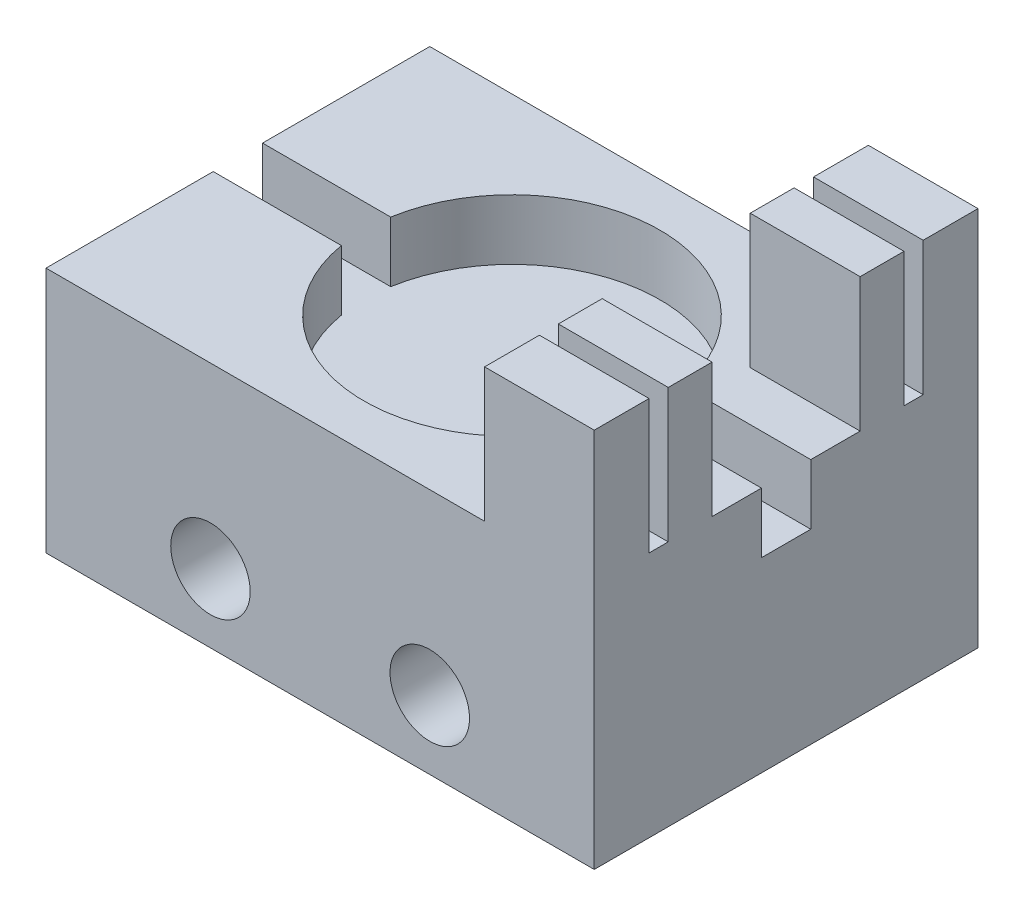
from build123d import *

# Parameters (mm, degrees)
SKETCH1_W           = 50
SKETCH1_H           = 22.5
BOSS_EXTRUDE1_DEPTH = 35
SKETCH2_R           = 3.625
CUT_EXTRUDE1_DEPTH  = 35
CUT_EXTRUDE2_DEPTH  = 5.5
SKETCH4_W           = 10
SKETCH4_H           = 5
SKETCH4_W_2         = 10.024005515
SKETCH4_H_2         = 4
BOSS_EXTRUDE2_DEPTH = 12.2


with BuildPart() as part:
    # Sketch1 → Boss-Extrude1 (new body)
    with BuildSketch(Plane.XY):
        Rectangle(SKETCH1_W, SKETCH1_H)
    extrude(amount=BOSS_EXTRUDE1_DEPTH)

    # Sketch2 → Cut-Extrude1 (cut)
    with BuildSketch(Plane.XY.offset(35)):
        with Locations((10, -5)):
            Circle(SKETCH2_R)
        with Locations((-10, -5)):
            Circle(SKETCH2_R)
    extrude(amount=-CUT_EXTRUDE1_DEPTH, mode=Mode.SUBTRACT)

    # Sketch3 → Cut-Extrude2 (cut)
    with BuildSketch(Plane(origin=(0, 11.25, 0), x_dir=(1, 0, 0), z_dir=(0, 1, 0))):
        with BuildLine():
            Line((25, -19.75), (13.311179512, -19.75))
            ThreePointArc((13.311179512, -19.75), (0, -31), (-13.311179512, -19.75))
            Line((-13.311179512, -19.75), (-25, -19.75))
            Line((-25, -19.75), (-25, -15.25))
            Line((-25, -15.25), (-13.311179512, -15.25))
            ThreePointArc((-13.311179512, -15.25), (0, -4), (13.311179512, -15.25))
            Line((13.311179512, -15.25), (25, -15.25))
            Line((25, -15.25), (25, -19.75))
        make_face()
    extrude(amount=-CUT_EXTRUDE2_DEPTH, mode=Mode.SUBTRACT)

    # Sketch4 → Boss-Extrude2 (add)
    with BuildSketch(Plane(origin=(0, 11.25, 0), x_dir=(1, 0, 0), z_dir=(0, 1, 0))):
        with Locations((20, -2.5)):
            Rectangle(SKETCH4_W, SKETCH4_H)
        with Locations((19.987997243, -8.75)):
            Rectangle(SKETCH4_W_2, SKETCH4_H_2)
        with Locations((19.987997243, -26.25)):
            Rectangle(SKETCH4_W_2, SKETCH4_H_2)
        with Locations((20, -32.5)):
            Rectangle(SKETCH4_W, SKETCH4_H)
    extrude(amount=BOSS_EXTRUDE2_DEPTH)


solid = part.part
